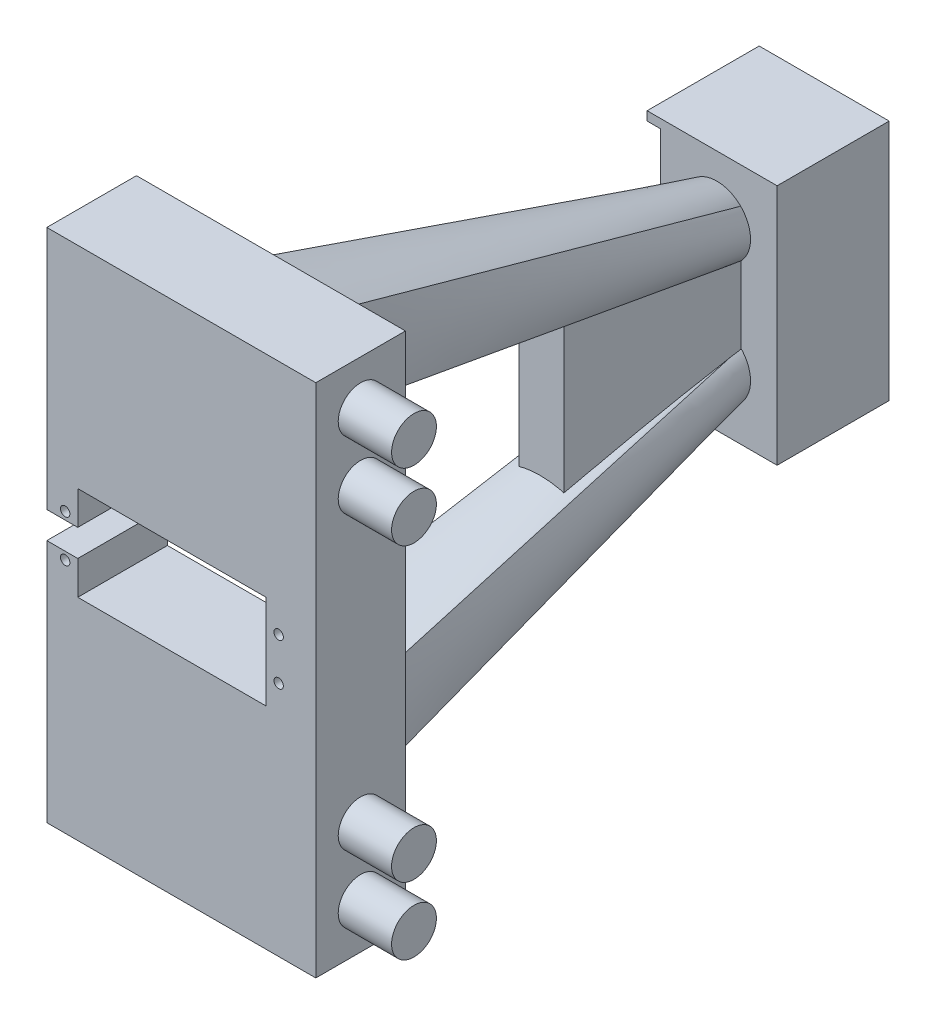
from build123d import *

# Parameters (mm, degrees)
SKETCH_5_W            = 60
SKETCH_5_H            = 115
EXTRUDE_2_DEPTH       = 20
SKETCH_1_R            = 1.05
CUT_EXTRUDE_4_DEPTH   = 20
SKETCH_6_R            = 5
EXTRUDE_3_DEPTH       = 12
EXTRUDE_6_DEPTH       = 3
EXTRUDE_6_DEPTH_BACK  = 26
SKETCH_13_W           = 25
SKETCH_13_H           = 54
SKETCH_16_W           = 22
SKETCH_16_H           = 50
CUT_EXTRUDE_9_DEPTH   = 3
SKETCH_17_W           = 5
SKETCH_17_H           = 15
CUT_EXTRUDE_10_DEPTH  = 8
EXTRUDE_13_DEPTH      = 5
EXTRUDE_13_DEPTH_BACK = 5


with BuildPart() as part:
    # 草圖5 → 填料-伸長2 (new body)
    with BuildSketch(Plane.XY):
        with Locations((85.095319229, -3)):
            Rectangle(SKETCH_5_W, SKETCH_5_H)
    extrude(amount=EXTRUDE_2_DEPTH)

    # 草圖1 → 除料-伸長4 (cut)
    with BuildSketch(Plane.XY):
        with Locations((59.19, 1.7)):
            Circle(SKETCH_1_R)
        with Locations((106.81, 1.7)):
            Circle(SKETCH_1_R)
        with Locations(Location((106.81, -7.7, 0), (0, 0, 180))):
            Circle(SKETCH_1_R)
        with Locations(Location((59.19, -7.7, 0), (0, 0, 180))):
            Circle(SKETCH_1_R)
        Polygon((55, -3), (55, 0), (62, 0), (62, 7.5), (104, 7.5), (104, -13.5), (62, -13.5), (62, -6), (55, -6), align=None)
    extrude(amount=CUT_EXTRUDE_4_DEPTH, mode=Mode.SUBTRACT)

    # 草圖6 → 填料-伸長3 (add)
    with BuildSketch(Plane(origin=(115, 0, 0), x_dir=(0, 0, -1), z_dir=(1, 0, 0))):
        with Locations(Location((-10, 44.5, 0), (0, 0, 270))):
            Circle(SKETCH_6_R)
        with Locations(Location((-10, 29.5, 0), (0, 0, 270))):
            Circle(SKETCH_6_R)
        with Locations(Location((-10, -35.5, 0), (0, 0, 180))):
            Circle(SKETCH_6_R)
        with Locations(Location((-10, -50.5, 0), (0, 0, 180))):
            Circle(SKETCH_6_R)
    extrude(amount=EXTRUDE_3_DEPTH)


with BuildPart() as body_2:
    # 草圖13 → 填料-伸長6 (new, two sides: drawn at the far end of the back side and taken through both)
    with BuildSketch(Plane(origin=(95, 0, 0), x_dir=(0, 0, -1), z_dir=(1, 0, 0)).offset(-EXTRUDE_6_DEPTH_BACK)):
        with Locations((112.5, -3)):
            Rectangle(SKETCH_13_W, SKETCH_13_H)
    extrude(amount=EXTRUDE_6_DEPTH + EXTRUDE_6_DEPTH_BACK)

    # 草圖16 → 除料-伸長9 (cut)
    with BuildSketch(Plane(origin=(69, 0, 0), x_dir=(0, 0, -1), z_dir=(1, 0, 0))):
        with Locations((111, -3)):
            Rectangle(SKETCH_16_W, SKETCH_16_H)
    extrude(amount=CUT_EXTRUDE_9_DEPTH, mode=Mode.SUBTRACT)

    # 草圖17 → 除料-伸長10 (cut)
    with BuildSketch(Plane(origin=(69, 0, 0), x_dir=(0, 0, -1), z_dir=(1, 0, 0))):
        with Locations((102.5, -3)):
            Rectangle(SKETCH_17_W, SKETCH_17_H)
    extrude(amount=CUT_EXTRUDE_10_DEPTH, mode=Mode.SUBTRACT)


with BuildPart() as body_3:
    # 草圖21 → 填料-伸長13 (new, two sides: drawn at the far end of the back side and taken through both)
    with BuildSketch(Plane(origin=(85, 0, 0), x_dir=(0, 0, -1), z_dir=(1, 0, 0)).offset(-EXTRUDE_13_DEPTH_BACK)):
        Polygon((60.419110579, 14.282390183), (60.419110579, -20.282390183), (100, -11.88497246), (99.903514788, -3), (100, 5.88497246), align=None)
    extrude(amount=EXTRUDE_13_DEPTH + EXTRUDE_13_DEPTH_BACK)


with BuildPart() as body_4:
    # Knit 1: read off the stored shape, not the designer's step
    # Knit 1: loft between two sections, ruled curve by curve
    knit_1_from = [
        Edge.make_bspline([(79.266895317, 5.377196179, -100), (79.579395317, 5.064696179, -100), (79.931362244, 4.768290315, -100), (80.709511323, 4.233165726, -100), (81.135733214, 3.994620259, -100), (82.046998926, 3.600245646, -100), (82.531971403, 3.444609801, -100), (83.534778832, 3.234670337, -100), (84.052429223, 3.180497037, -100), (85.087963129, 3.180497037, -100), (85.60561352, 3.234670337, -100), (86.608420949, 3.444609801, -100), (87.093393426, 3.600245646, -100), (88.004659138, 3.994620259, -100), (88.430881029, 4.233165726, -100), (89.209030109, 4.768290315, -100), (89.560997035, 5.064696179, -100), (89.873497035, 5.377196179, -100)], [0, 0, 0, 0, 0.125, 0.125, 0.25, 0.25, 0.375, 0.375, 0.5, 0.5, 0.625, 0.625, 0.75, 0.75, 0.875, 0.875, 1, 1, 1, 1], 3),
        Edge.make_bspline([(89.873497035, 5.377196179, -100), (90.185997035, 5.689696179, -100), (90.482402899, 6.041663105, -100), (91.017527488, 6.819812184, -100), (91.256072955, 7.246034075, -100), (91.650447568, 8.157299787, -100), (91.806083413, 8.642272265, -100), (92.016022877, 9.645079694, -100), (92.070196176, 10.162730084, -100), (92.070196176, 11.19826399, -100), (92.016022877, 11.715914381, -100), (91.806083413, 12.71872181, -100), (91.650447568, 13.203694288, -100), (91.256072955, 14.11496, -100), (91.017527488, 14.541181891, -100), (90.482402899, 15.31933097, -100), (90.185997035, 15.671297896, -100), (89.873497035, 15.983797896, -100)], [0, 0, 0, 0, 0.125, 0.125, 0.25, 0.25, 0.375, 0.375, 0.5, 0.5, 0.625, 0.625, 0.75, 0.75, 0.875, 0.875, 1, 1, 1, 1], 3),
        Edge.make_bspline([(79.266895317, 15.983797896, -100), (78.954395317, 15.671297896, -100), (78.657989454, 15.31933097, -100), (78.122864864, 14.541181891, -100), (77.884319398, 14.11496, -100), (77.489944785, 13.203694288, -100), (77.334308939, 12.71872181, -100), (77.124369476, 11.715914381, -100), (77.070196176, 11.19826399, -100), (77.070196176, 10.162730084, -100), (77.124369476, 9.645079694, -100), (77.334308939, 8.642272265, -100), (77.489944785, 8.157299787, -100), (77.884319398, 7.246034075, -100), (78.122864864, 6.819812184, -100), (78.657989454, 6.041663105, -100), (78.954395317, 5.689696179, -100), (79.266895317, 5.377196179, -100)], [0, 0, 0, 0, 0.125, 0.125, 0.25, 0.25, 0.375, 0.375, 0.5, 0.5, 0.625, 0.625, 0.75, 0.75, 0.875, 0.875, 1, 1, 1, 1], 3),
        Edge.make_bspline([(89.873497035, 15.983797896, -100), (89.560997035, 16.296297896, -100), (89.209030109, 16.59270376, -100), (88.430881029, 17.127828349, -100), (88.004659138, 17.366373816, -100), (87.093393426, 17.760748429, -100), (86.608420949, 17.916384274, -100), (85.60561352, 18.126323738, -100), (85.087963129, 18.180497037, -100), (84.052429223, 18.180497037, -100), (83.534778832, 18.126323738, -100), (82.531971403, 17.916384274, -100), (82.046998926, 17.760748429, -100), (81.135733214, 17.366373816, -100), (80.709511323, 17.127828349, -100), (79.931362244, 16.59270376, -100), (79.579395317, 16.296297896, -100), (79.266895317, 15.983797896, -100)], [0, 0, 0, 0, 0.125, 0.125, 0.25, 0.25, 0.375, 0.375, 0.5, 0.5, 0.625, 0.625, 0.75, 0.75, 0.875, 0.875, 1, 1, 1, 1], 3),
    ]
    knit_1_to = [
        Edge.make_bspline([(75, 27.5, 0), (75.833333333, 27.5, 0), (76.666666667, 27.5, 0), (78.333333333, 27.5, 0), (79.166666667, 27.5, 0), (80.833333333, 27.5, 0), (81.666666667, 27.5, 0), (83.333333333, 27.5, 0), (84.166666667, 27.5, 0), (85.833333333, 27.5, 0), (86.666666667, 27.5, 0), (88.333333333, 27.5, 0), (89.166666667, 27.5, 0), (90.833333333, 27.5, 0), (91.666666667, 27.5, 0), (93.333333333, 27.5, 0), (94.166666667, 27.5, 0), (95, 27.5, 0)], [0, 0, 0, 0, 0.125, 0.125, 0.25, 0.25, 0.375, 0.375, 0.5, 0.5, 0.625, 0.625, 0.75, 0.75, 0.875, 0.875, 1, 1, 1, 1], 3),
        Edge.make_bspline([(95, 27.5, 0), (95, 28.333333333, 0), (95, 29.166666667, 0), (95, 30.833333333, 0), (95, 31.666666667, 0), (95, 33.333333333, 0), (95, 34.166666667, 0), (95, 35.833333333, 0), (95, 36.666666667, 0), (95, 38.333333333, 0), (95, 39.166666667, 0), (95, 40.833333333, 0), (95, 41.666666667, 0), (95, 43.333333333, 0), (95, 44.166666667, 0), (95, 45.833333333, 0), (95, 46.666666667, 0), (95, 47.5, 0)], [0, 0, 0, 0, 0.125, 0.125, 0.25, 0.25, 0.375, 0.375, 0.5, 0.5, 0.625, 0.625, 0.75, 0.75, 0.875, 0.875, 1, 1, 1, 1], 3),
        Edge.make_bspline([(75, 47.5, 0), (75, 46.666666667, 0), (75, 45.833333333, 0), (75, 44.166666667, 0), (75, 43.333333333, 0), (75, 41.666666667, 0), (75, 40.833333333, 0), (75, 39.166666667, 0), (75, 38.333333333, 0), (75, 36.666666667, 0), (75, 35.833333333, 0), (75, 34.166666667, 0), (75, 33.333333333, 0), (75, 31.666666667, 0), (75, 30.833333333, 0), (75, 29.166666667, 0), (75, 28.333333333, 0), (75, 27.5, 0)], [0, 0, 0, 0, 0.125, 0.125, 0.25, 0.25, 0.375, 0.375, 0.5, 0.5, 0.625, 0.625, 0.75, 0.75, 0.875, 0.875, 1, 1, 1, 1], 3),
        Edge.make_bspline([(95, 47.5, 0), (94.166666667, 47.5, 0), (93.333333333, 47.5, 0), (91.666666667, 47.5, 0), (90.833333333, 47.5, 0), (89.166666667, 47.5, 0), (88.333333333, 47.5, 0), (86.666666667, 47.5, 0), (85.833333333, 47.5, 0), (84.166666667, 47.5, 0), (83.333333333, 47.5, 0), (81.666666667, 47.5, 0), (80.833333333, 47.5, 0), (79.166666667, 47.5, 0), (78.333333333, 47.5, 0), (76.666666667, 47.5, 0), (75.833333333, 47.5, 0), (75, 47.5, 0)], [0, 0, 0, 0, 0.125, 0.125, 0.25, 0.25, 0.375, 0.375, 0.5, 0.5, 0.625, 0.625, 0.75, 0.75, 0.875, 0.875, 1, 1, 1, 1], 3),
    ]
    knit_1 = Solid(Shell([*[Face.make_surface_from_curves(knit_1_from[k], knit_1_to[k]) for k in range(4)], Face(Wire(knit_1_from)), Face(Wire(knit_1_to))]))
    add(knit_1)


with BuildPart() as body_5:
    # Knit 2: read off the stored shape, not the designer's step
    # Knit 2: loft between two sections, ruled curve by curve
    knit_2_from = [
        Edge.make_bspline([(79.266895317, -21.983797896, -100), (79.579395317, -22.296297896, -100), (79.931362244, -22.59270376, -100), (80.709511323, -23.127828349, -100), (81.135733214, -23.366373816, -100), (82.046998926, -23.760748429, -100), (82.531971403, -23.916384274, -100), (83.534778832, -24.126323738, -100), (84.052429223, -24.180497037, -100), (85.087963129, -24.180497037, -100), (85.60561352, -24.126323738, -100), (86.608420949, -23.916384274, -100), (87.093393426, -23.760748429, -100), (88.004659138, -23.366373816, -100), (88.430881029, -23.127828349, -100), (89.209030109, -22.59270376, -100), (89.560997035, -22.296297896, -100), (89.873497035, -21.983797896, -100)], [0, 0, 0, 0, 0.125, 0.125, 0.25, 0.25, 0.375, 0.375, 0.5, 0.5, 0.625, 0.625, 0.75, 0.75, 0.875, 0.875, 1, 1, 1, 1], 3),
        Edge.make_bspline([(89.873497035, -21.983797896, -100), (90.185997035, -21.671297896, -100), (90.482402899, -21.31933097, -100), (91.017527488, -20.541181891, -100), (91.256072955, -20.11496, -100), (91.650447568, -19.203694288, -100), (91.806083413, -18.71872181, -100), (92.016022877, -17.715914381, -100), (92.070196176, -17.19826399, -100), (92.070196176, -16.162730084, -100), (92.016022877, -15.645079694, -100), (91.806083413, -14.642272265, -100), (91.650447568, -14.157299787, -100), (91.256072955, -13.246034075, -100), (91.017527488, -12.819812184, -100), (90.482402899, -12.041663105, -100), (90.185997035, -11.689696179, -100), (89.873497035, -11.377196179, -100)], [0, 0, 0, 0, 0.125, 0.125, 0.25, 0.25, 0.375, 0.375, 0.5, 0.5, 0.625, 0.625, 0.75, 0.75, 0.875, 0.875, 1, 1, 1, 1], 3),
        Edge.make_bspline([(79.266895317, -11.377196179, -100), (78.954395317, -11.689696179, -100), (78.657989454, -12.041663105, -100), (78.122864864, -12.819812184, -100), (77.884319398, -13.246034075, -100), (77.489944785, -14.157299787, -100), (77.334308939, -14.642272265, -100), (77.124369476, -15.645079694, -100), (77.070196176, -16.162730084, -100), (77.070196176, -17.19826399, -100), (77.124369476, -17.715914381, -100), (77.334308939, -18.71872181, -100), (77.489944785, -19.203694288, -100), (77.884319398, -20.11496, -100), (78.122864864, -20.541181891, -100), (78.657989454, -21.31933097, -100), (78.954395317, -21.671297896, -100), (79.266895317, -21.983797896, -100)], [0, 0, 0, 0, 0.125, 0.125, 0.25, 0.25, 0.375, 0.375, 0.5, 0.5, 0.625, 0.625, 0.75, 0.75, 0.875, 0.875, 1, 1, 1, 1], 3),
        Edge.make_bspline([(89.873497035, -11.377196179, -100), (89.560997035, -11.064696179, -100), (89.209030109, -10.768290315, -100), (88.430881029, -10.233165726, -100), (88.004659138, -9.994620259, -100), (87.093393426, -9.600245646, -100), (86.608420949, -9.444609801, -100), (85.60561352, -9.234670337, -100), (85.087963129, -9.180497037, -100), (84.052429223, -9.180497037, -100), (83.534778832, -9.234670337, -100), (82.531971403, -9.444609801, -100), (82.046998926, -9.600245646, -100), (81.135733214, -9.994620259, -100), (80.709511323, -10.233165726, -100), (79.931362244, -10.768290315, -100), (79.579395317, -11.064696179, -100), (79.266895317, -11.377196179, -100)], [0, 0, 0, 0, 0.125, 0.125, 0.25, 0.25, 0.375, 0.375, 0.5, 0.5, 0.625, 0.625, 0.75, 0.75, 0.875, 0.875, 1, 1, 1, 1], 3),
    ]
    knit_2_to = [
        Edge.make_bspline([(75, -53.5, 0), (75.833333333, -53.5, 0), (76.666666667, -53.5, 0), (78.333333333, -53.5, 0), (79.166666667, -53.5, 0), (80.833333333, -53.5, 0), (81.666666667, -53.5, 0), (83.333333333, -53.5, 0), (84.166666667, -53.5, 0), (85.833333333, -53.5, 0), (86.666666667, -53.5, 0), (88.333333333, -53.5, 0), (89.166666667, -53.5, 0), (90.833333333, -53.5, 0), (91.666666667, -53.5, 0), (93.333333333, -53.5, 0), (94.166666667, -53.5, 0), (95, -53.5, 0)], [0, 0, 0, 0, 0.125, 0.125, 0.25, 0.25, 0.375, 0.375, 0.5, 0.5, 0.625, 0.625, 0.75, 0.75, 0.875, 0.875, 1, 1, 1, 1], 3),
        Edge.make_bspline([(95, -53.5, 0), (95, -52.666666667, 0), (95, -51.833333333, 0), (95, -50.166666667, 0), (95, -49.333333333, 0), (95, -47.666666667, 0), (95, -46.833333333, 0), (95, -45.166666667, 0), (95, -44.333333333, 0), (95, -42.666666667, 0), (95, -41.833333333, 0), (95, -40.166666667, 0), (95, -39.333333333, 0), (95, -37.666666667, 0), (95, -36.833333333, 0), (95, -35.166666667, 0), (95, -34.333333333, 0), (95, -33.5, 0)], [0, 0, 0, 0, 0.125, 0.125, 0.25, 0.25, 0.375, 0.375, 0.5, 0.5, 0.625, 0.625, 0.75, 0.75, 0.875, 0.875, 1, 1, 1, 1], 3),
        Edge.make_bspline([(75, -33.5, 0), (75, -34.333333333, 0), (75, -35.166666667, 0), (75, -36.833333333, 0), (75, -37.666666667, 0), (75, -39.333333333, 0), (75, -40.166666667, 0), (75, -41.833333333, 0), (75, -42.666666667, 0), (75, -44.333333333, 0), (75, -45.166666667, 0), (75, -46.833333333, 0), (75, -47.666666667, 0), (75, -49.333333333, 0), (75, -50.166666667, 0), (75, -51.833333333, 0), (75, -52.666666667, 0), (75, -53.5, 0)], [0, 0, 0, 0, 0.125, 0.125, 0.25, 0.25, 0.375, 0.375, 0.5, 0.5, 0.625, 0.625, 0.75, 0.75, 0.875, 0.875, 1, 1, 1, 1], 3),
        Edge.make_bspline([(95, -33.5, 0), (94.166666667, -33.5, 0), (93.333333333, -33.5, 0), (91.666666667, -33.5, 0), (90.833333333, -33.5, 0), (89.166666667, -33.5, 0), (88.333333333, -33.5, 0), (86.666666667, -33.5, 0), (85.833333333, -33.5, 0), (84.166666667, -33.5, 0), (83.333333333, -33.5, 0), (81.666666667, -33.5, 0), (80.833333333, -33.5, 0), (79.166666667, -33.5, 0), (78.333333333, -33.5, 0), (76.666666667, -33.5, 0), (75.833333333, -33.5, 0), (75, -33.5, 0)], [0, 0, 0, 0, 0.125, 0.125, 0.25, 0.25, 0.375, 0.375, 0.5, 0.5, 0.625, 0.625, 0.75, 0.75, 0.875, 0.875, 1, 1, 1, 1], 3),
    ]
    knit_2 = Solid(Shell([*[Face.make_surface_from_curves(knit_2_from[k], knit_2_to[k]) for k in range(4)], Face(Wire(knit_2_from)), Face(Wire(knit_2_to))]))
    add(knit_2)


solid = Compound([part.part, body_2.part, body_3.part, body_4.part, body_5.part])
